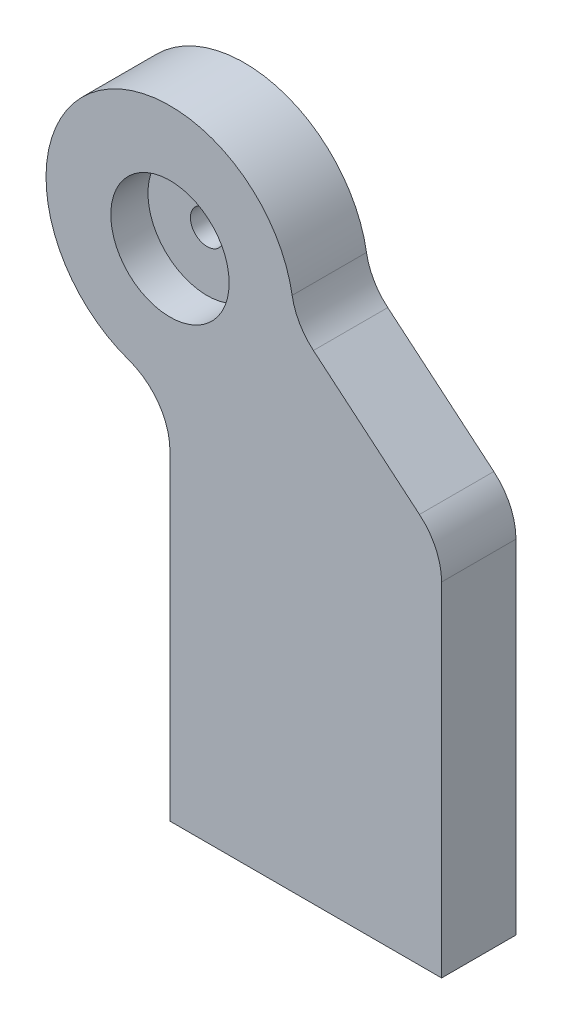
from build123d import *

# Parameters (mm, degrees)
SKETCH1_R           = 2.7
BOSS_EXTRUDE1_DEPTH = 12
SKETCH2_R           = 9.55
CUT_EXTRUDE1_DEPTH  = 6
FILLET1_R           = 10
SKETCH3_R           = 1.7
CUT_EXTRUDE2_DEPTH  = 12
LPATTERN1_COUNT     = 4
LPATTERN1_PITCH     = 10


with BuildPart() as part:
    # Sketch1 → Boss-Extrude1 (new body)
    with BuildSketch(Plane.XY):
        with BuildLine():
            Line((0, 60), (0, 0))
            Line((0, 0), (43.835071852, 0))
            Line((43.835071852, 0), (43.835071852, 60))
            Line((43.835071852, 60), (20, 80))
            ThreePointArc((20, 80), (-14.142135624, 94.142135624), (0, 60))
        make_face()
        with Locations((0, 80)):
            Circle(SKETCH1_R, mode=Mode.SUBTRACT)
    extrude(amount=BOSS_EXTRUDE1_DEPTH)

    # Sketch2 → Cut-Extrude1 (cut)
    with BuildSketch(Plane.XY.offset(12)):
        with Locations((0, 80)):
            Circle(SKETCH2_R)
    extrude(amount=-CUT_EXTRUDE1_DEPTH, mode=Mode.SUBTRACT)

    # Fillet1
    fillet1_edges = [part.edges().sort_by_distance(p)[0] for p in [
        (20, 80, 6),
        (0, 60, 6),
        (43.835071852, 60, 6),
    ]]
    fillet(fillet1_edges, radius=FILLET1_R)

    # Sketch3 → Cut-Extrude2 (cut)
    with BuildSketch(Plane.XZ):
        with Locations((7.5, 6)):
            Circle(SKETCH3_R)
    cut_extrude2 = extrude(amount=-CUT_EXTRUDE2_DEPTH, mode=Mode.SUBTRACT)

    # LPattern1: Cut-Extrude2 ×4
    with Locations(*[(i * LPATTERN1_PITCH, 0, 0) for i in range(1, LPATTERN1_COUNT)]):
        add(cut_extrude2, mode=Mode.SUBTRACT)


solid = part.part
